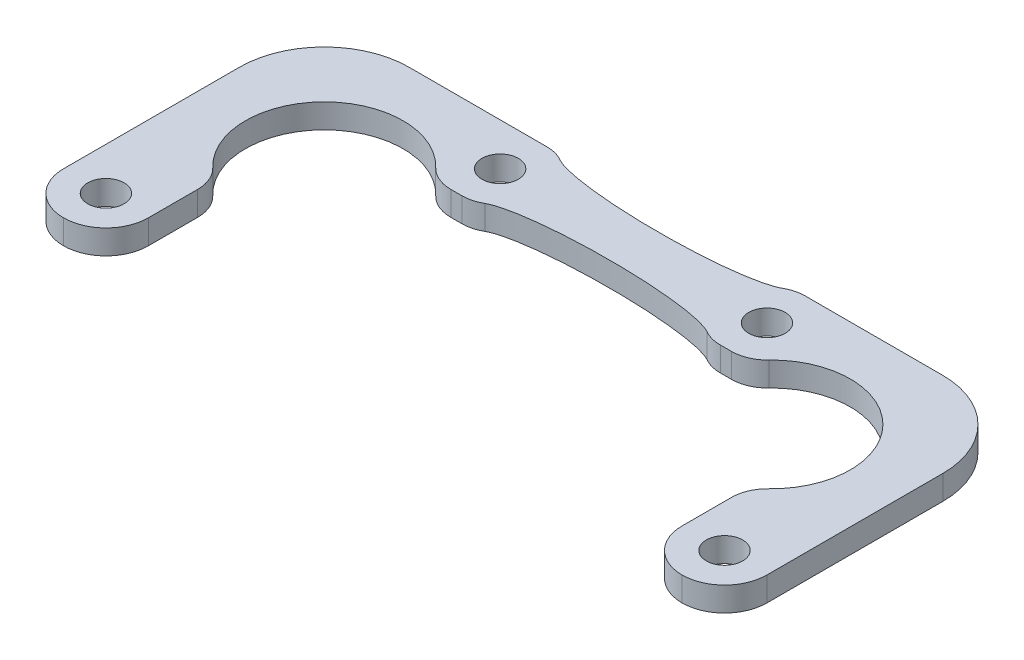
from build123d import *

# Parameters (mm, degrees)
SKETCH1_R      = 1.5
EXTRUDE1_DEPTH = 2
FILLET1_R      = 3
FILLET2_R      = 3.5
EXTRUDE2_DEPTH = 2
EXTRUDE3_DEPTH = 2
FILLET3_R      = 3
FILLET5_R      = 7


with BuildPart() as part:
    # Sketch1 → Extrude1 (new body)
    # profile 1 of 2: a face of its own
    with BuildSketch(Plane(origin=(0, 0, 0), x_dir=(1, 0, 0), z_dir=(0, 1, 0))):
        Polygon((-22, 0), (0, 0), (0, 7), (-29, 7), (-29, -18), (-22, -18), align=None)
        with Locations(Location((-25.5, -14.5, 0), (0, 0, 270))):
            Circle(SKETCH1_R, mode=Mode.SUBTRACT)
        with Locations(Location((-11, 3.5, 0), (0, 0, 270))):
            Circle(SKETCH1_R, mode=Mode.SUBTRACT)
    # profile 2 of 2: a face of its own
    with BuildSketch(Plane(origin=(0, 0, 0), x_dir=(1, 0, 0), z_dir=(0, 1, 0))):
        Polygon((0, 0), (22, 0), (22, -18), (29, -18), (29, 7), (0, 7), align=None)
        with Locations(Location((25.5, -14.5, 0), (0, 0, 270))):
            Circle(SKETCH1_R, mode=Mode.SUBTRACT)
        with Locations(Location((11, 3.5, 0), (0, 0, 270))):
            Circle(SKETCH1_R, mode=Mode.SUBTRACT)
    extrude(amount=EXTRUDE1_DEPTH)

    # Fillet1
    fillet1_edges = [part.edges().sort_by_distance(p)[0] for p in [
        (-22, 1, 0),
        (22, 1, 0),
    ]]
    fillet(fillet1_edges, radius=FILLET1_R)

    # Fillet2
    fillet2_edges = [part.edges().sort_by_distance(p)[0] for p in [
        (29, 1, 18),
        (22, 1, 18),
        (-22, 1, 18),
        (-29, 1, 18),
    ]]
    fillet(fillet2_edges, radius=FILLET2_R - 0.0001)  # a hair under: the kernel refuses the full size

    # Sketch2 → Extrude2 (cut)
    with BuildSketch(Plane(origin=(0, 2, 0), x_dir=(1, 0, 0), z_dir=(0, 1, 0))):
        with BuildLine():
            Line((-9.5, 7), (9.5, 7))
            add(Edge.make_bspline(
                [(-9.5, 7), (-9.5, 5.5), (0, 5.5), (9.5, 5.5), (9.5, 7)],
                knots=[0, 0, 0, 1.570796327, 1.570796327, 3.141592654, 3.141592654, 3.141592654], degree=2, weights=[1, 0.707106781, 1, 0.707106781, 1]))
        make_face()
    extrude2 = extrude(amount=-EXTRUDE2_DEPTH, mode=Mode.SUBTRACT)

    # Mirror1: Extrude2 across plane
    add(extrude2.mirror(Plane(origin=(0, 0, -3.5), x_dir=(1, 0, 0), z_dir=(0, 0, -1))), mode=Mode.SUBTRACT)

    # Sketch3 → Extrude3 (cut)
    with BuildSketch(Plane(origin=(0, 2, 0), x_dir=(-1, 0, 0), z_dir=(0, 1, 0))):
        with BuildLine():
            Line((-13, 0), (-19, 0))
            ThreePointArc((-19, 0), (-21.121320344, 0.878679656), (-22, 3))
            Line((-22, 3), (-22, 9))
            ThreePointArc((-22, 9), (-23.031608424, -1.031608424), (-13, 0))
        make_face()
    extrude3 = extrude(amount=-EXTRUDE3_DEPTH, mode=Mode.SUBTRACT)

    # Mirror4: Extrude3 across plane
    add(extrude3.mirror(Plane(origin=(0, 0, 0), x_dir=(0, 0, 1), z_dir=(1, 0, 0))), mode=Mode.SUBTRACT)

    # Fillet3
    fillet3_edges = [part.edges().sort_by_distance(p)[0] for p in [
        (9.5, 1, 0),
        (-9.5, 1, 0),
        (22, 1, 9),
        (13, 1, 0),
        (-9.5, 1, -7),
        (9.5, 1, -7),
        (-22, 1, 9),
        (-13, 1, 0),
    ]]
    fillet(fillet3_edges, radius=FILLET3_R)

    # Fillet5
    fillet5_edges = [part.edges().sort_by_distance(p)[0] for p in [
        (-29, 1, -7),
        (29, 1, -7),
    ]]
    fillet(fillet5_edges, radius=FILLET5_R)


solid = part.part
